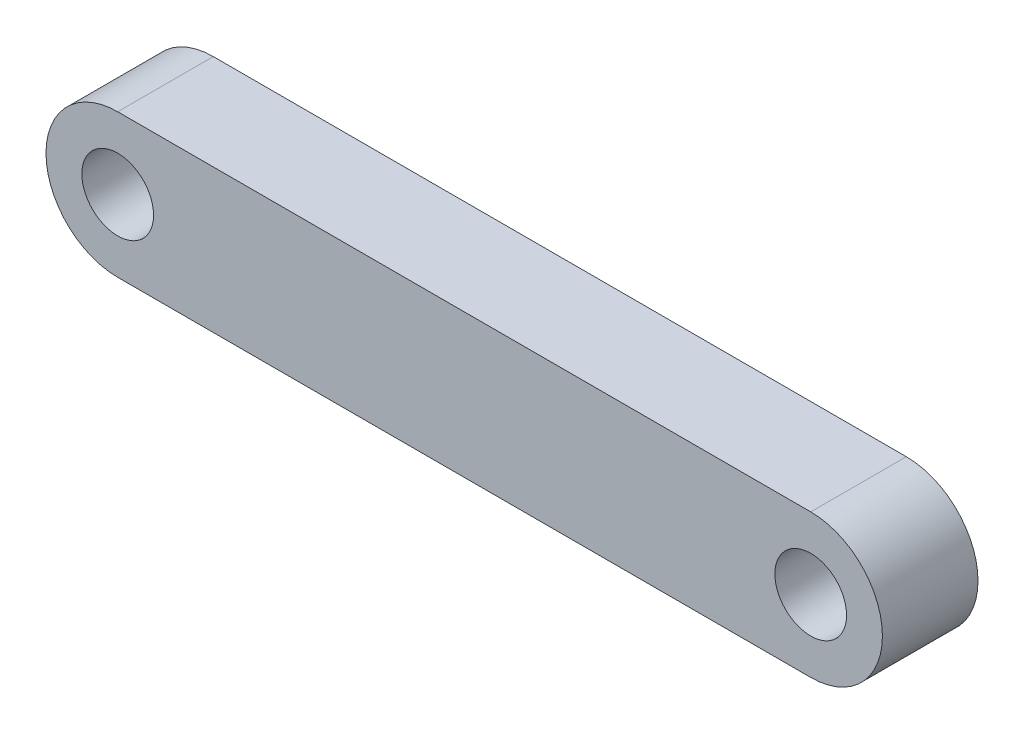
from build123d import *

# Parameters (mm, degrees)
SKETCH1_R           = 1.499999939
SKETCH1_R_2         = 1.500000027
BOSS_EXTRUDE1_DEPTH = 4


# Read off the part's stored shape, not the designer's step: Imported1
with BuildPart() as part:
    # Sketch1 → Boss-Extrude1 (new body)
    with BuildSketch(Plane.XY.offset(4.00000019)):
        with BuildLine():
            Line((3.000000022, 6.000000052), (31.999998375, 6.000000052))
            ThreePointArc((31.999998375, 6.000000052), (34.999998401, 3.000000026), (31.999998375, 0))
            Line((31.999998375, 0), (3.000000022, 0))
            ThreePointArc((3.000000022, 0), (-4e-09, 3.000000026), (3.000000022, 6.000000052))
        make_face()
        with Locations((2.99999964, 3.000000084)):
            Circle(SKETCH1_R, mode=Mode.SUBTRACT)
        with Locations((31.999999178, 3.000000026)):
            Circle(SKETCH1_R_2, mode=Mode.SUBTRACT)
    extrude(amount=BOSS_EXTRUDE1_DEPTH)


solid = part.part
